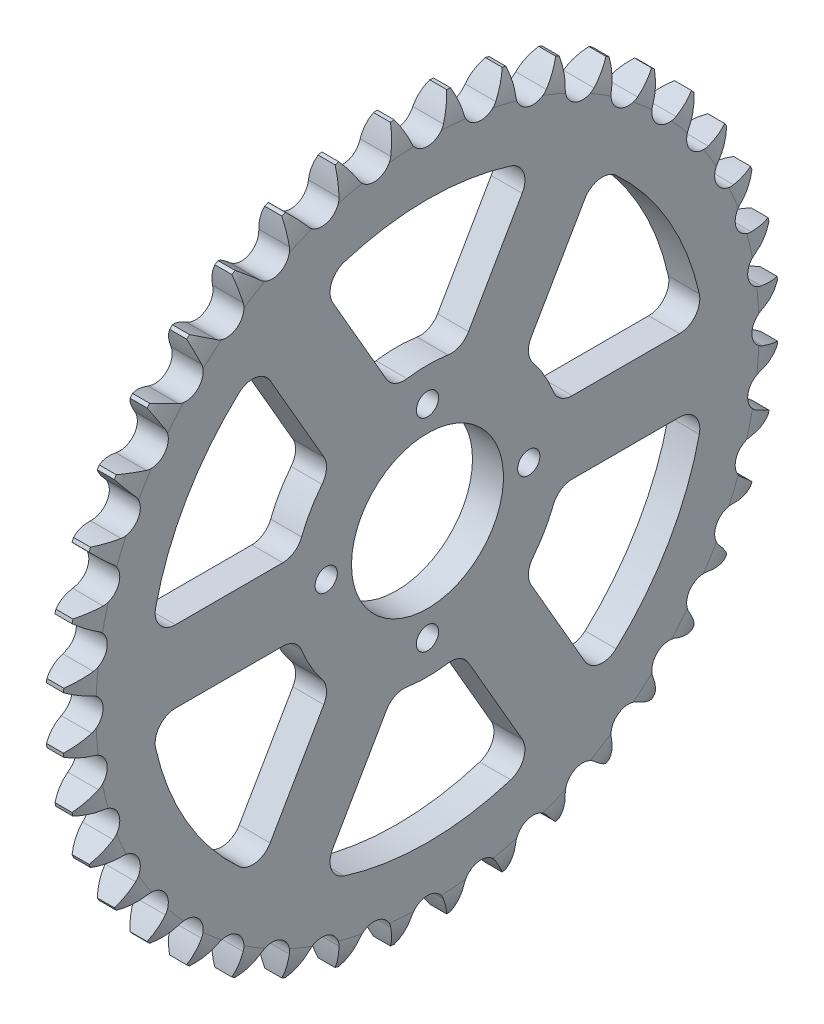
from build123d import *

# Parameters (mm, degrees)
TOOTHCUT_DEPTH     = 151.199737585
TEETHCUTS_COUNT    = 40
TEETHCUTS_ANGLE    = 351
BORSKE_R           = 22.5
BORE_DEPTH         = 50.0005
CUT_EXTRUDE2_DEPTH = 10
FILLET1_R          = 6
SKETCH2_R          = 3.3
CUT_EXTRUDE3_DEPTH = 10


with BuildPart() as part:
    # BasProSke → Base-Revolve (revolve)
    with BuildSketch(Plane(origin=(0, 0, 0), x_dir=(1, 0, 0), z_dir=(0, 1, 0))):
        with BuildLine():
            Line((0, 0), (0, 98.182044356))
            ThreePointArc((0, 98.182044356), (0.524605563, 102.229391094), (2.06375, 106.009240433))
            Line((2.06375, 106.009240433), (7.10375, 106.009240433))
            ThreePointArc((7.10375, 106.009240433), (8.642894437, 102.229391094), (9.1675, 98.182044356))
            Line((9.1675, 98.182044356), (9.1675, 0))
            Line((9.1675, 0), (0, 0))
        make_face()
    revolve(axis=Axis((-10, 0, 0), (1, 0, 0)))

    # TooCutSke → ToothCut (cut, through all)
    with BuildSketch(Plane(origin=(0, 0, 0), x_dir=(0, 0, -1), z_dir=(1, 0, 0))):
        with BuildLine():
            ThreePointArc((4.785991604, 99.369005351), (6.280055279, 102.84761528), (8.027046911, 106.206331334))
            ThreePointArc((8.027046911, 106.206331334), (0, 106.509240433), (-8.027046911, 106.206331334))
            ThreePointArc((-8.027046911, 106.206331334), (-6.280055279, 102.84761528), (-4.785991604, 99.369005351))
            ThreePointArc((-4.785991604, 99.369005351), (0, 96.087365433), (4.785991604, 99.369005351))
        make_face()
    toothcut = extrude(amount=TOOTHCUT_DEPTH, mode=Mode.SUBTRACT)

    # TeethCuts: ToothCut ×40 about axis
    teethcuts_axis = Axis((-10, 0, 0), (1, 0, 0))
    for i in range(1, TEETHCUTS_COUNT):
        add(toothcut.rotate(teethcuts_axis, i * TEETHCUTS_ANGLE / (TEETHCUTS_COUNT - 1)), mode=Mode.SUBTRACT)

    # BorSke → Bore (cut, symmetric)
    with BuildSketch(Plane(origin=(0, 0, 0), x_dir=(0, 0, -1), z_dir=(1, 0, 0))):
        Circle(BORSKE_R)
    extrude(amount=BORE_DEPTH, both=True, mode=Mode.SUBTRACT)

    # Sketch1 → Cut-Extrude2 (cut)
    with BuildSketch(Plane(origin=(9.1675, 0, 0), x_dir=(0, 0, -1), z_dir=(1, 0, 0))):
        with BuildLine():
            ThreePointArc((-10, 38.729833462), (0, 40), (10, 38.729833462))
            Line((10, 38.729833462), (31.630774368, 76.195433675))
            ThreePointArc((31.630774368, 76.195433675), (0, 82.5), (-31.630774368, 76.195433675))
            Line((-31.630774368, 76.195433675), (-10, 38.729833462))
        make_face()
        with BuildLine():
            Line((50.171794031, 65.490770981), (28.541019662, 28.025170769))
            ThreePointArc((28.541019662, 28.025170769), (34.641016151, 20), (38.541019662, 10.704662693))
            Line((38.541019662, 10.704662693), (81.802568399, 10.704662693))
            ThreePointArc((81.802568399, 10.704662693), (71.447095812, 41.25), (50.171794031, 65.490770981))
        make_face()
        with BuildLine():
            ThreePointArc((-38.541019662, 10.704662693), (-34.641016151, 20), (-28.541019662, 28.025170769))
            Line((-28.541019662, 28.025170769), (-50.171794031, 65.490770981))
            ThreePointArc((-50.171794031, 65.490770981), (-71.447095812, 41.25), (-81.802568399, 10.704662693))
            Line((-81.802568399, 10.704662693), (-38.541019662, 10.704662693))
        make_face()
        with BuildLine():
            Line((81.802568399, -10.704662693), (38.541019663, -10.704662693))
            ThreePointArc((38.541019662, -10.704662693), (34.641016151, -20), (28.541019662, -28.025170769))
            Line((28.541019663, -28.025170769), (50.171794031, -65.490770981))
            ThreePointArc((50.171794031, -65.490770981), (71.447095812, -41.25), (81.802568399, -10.704662693))
        make_face()
        with BuildLine():
            ThreePointArc((-28.541019662, -28.025170769), (-34.641016151, -20), (-38.541019662, -10.704662693))
            Line((-38.541019662, -10.704662693), (-81.802568399, -10.704662693))
            ThreePointArc((-81.802568399, -10.704662693), (-71.447095812, -41.25), (-50.171794031, -65.490770982))
            Line((-50.171794031, -65.490770982), (-28.541019662, -28.025170769))
        make_face()
        with BuildLine():
            Line((31.630774368, -76.195433675), (10, -38.729833462))
            ThreePointArc((10, -38.729833462), (0, -40), (-10, -38.729833462))
            Line((-10, -38.729833462), (-31.630774368, -76.195433675))
            ThreePointArc((-31.630774368, -76.195433675), (0, -82.5), (31.630774368, -76.195433675))
        make_face()
    extrude(amount=-CUT_EXTRUDE2_DEPTH, mode=Mode.SUBTRACT)

    # Fillet1
    fillet1_edges = [part.edges().sort_by_distance(p)[0] for p in [
        (4.58375, 76.195433675, 31.630774368),
        (4.58375, 76.195433675, -31.630774368),
        (4.58375, 38.729833462, 10),
        (4.58375, 38.729833462, -10),
        (4.58375, 28.025170769, -28.541019662),
        (4.58375, 10.704662693, -38.541019662),
        (4.58375, 10.704662693, -81.802568399),
        (4.58375, 65.490770981, -50.171794031),
        (4.58375, -65.490770981, -50.171794031),
        (4.58375, -10.704662693, -81.802568399),
        (4.58375, -10.704662693, -38.541019662),
        (4.58375, -28.025170769, -28.541019663),
        (4.58375, -76.195433675, 31.630774368),
        (4.58375, -76.195433675, -31.630774368),
        (4.58375, -38.729833462, 10),
        (4.58375, -38.729833462, -10),
        (4.58375, -28.025170769, 28.541019662),
        (4.58375, -10.704662693, 38.541019662),
        (4.58375, -10.704662693, 81.802568399),
        (4.58375, -65.490770982, 50.171794031),
        (4.58375, 10.704662693, 81.802568399),
        (4.58375, 65.490770981, 50.171794031),
        (4.58375, 10.704662693, 38.541019662),
        (4.58375, 28.025170769, 28.541019662),
    ]]
    fillet(fillet1_edges, radius=FILLET1_R)

    # Sketch2 → Cut-Extrude3 (cut)
    with BuildSketch(Plane(origin=(9.1675, 0, 0), x_dir=(0, 0, -1), z_dir=(1, 0, 0))):
        with Locations((30, 0)):
            Circle(SKETCH2_R)
        with Locations((0, -30)):
            Circle(SKETCH2_R)
        with Locations((-30, 0)):
            Circle(SKETCH2_R)
        with Locations((0, 30)):
            Circle(SKETCH2_R)
    extrude(amount=-CUT_EXTRUDE3_DEPTH, mode=Mode.SUBTRACT)


solid = part.part
